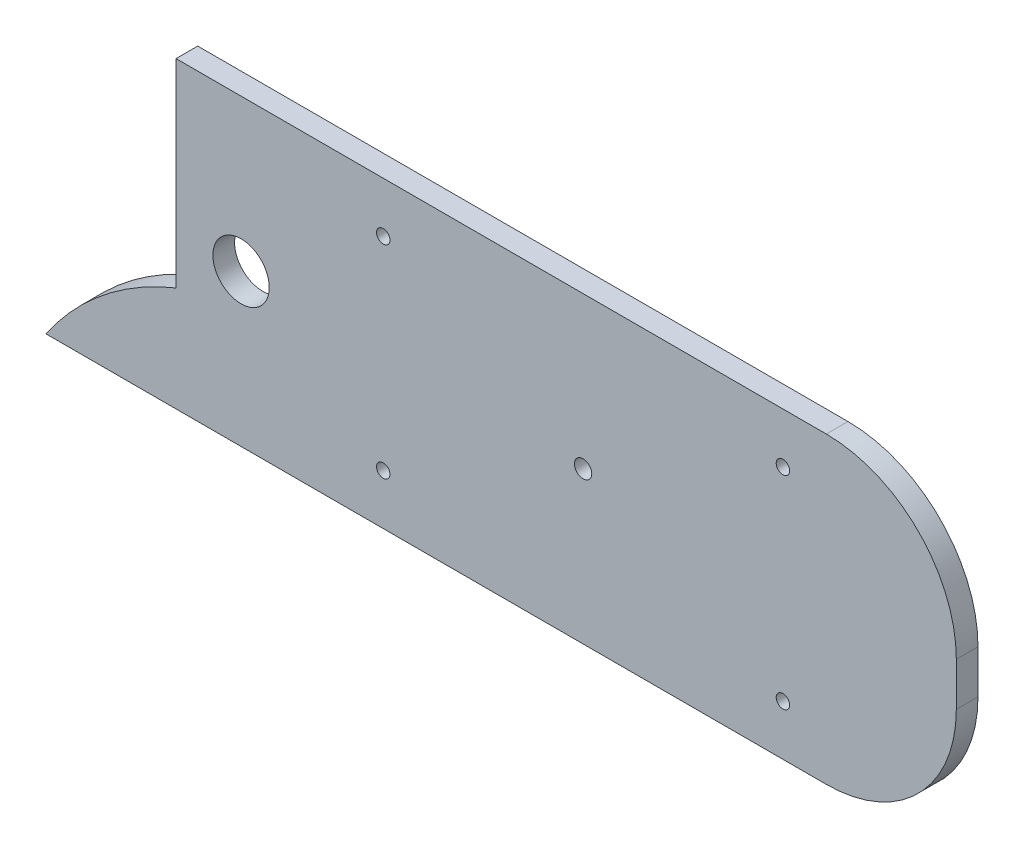
from build123d import *

# Parameters (mm, degrees)
BOSS_EXTRUDE1_DEPTH = 12.7
SKETCH4_R           = 5.08
SKETCH4_R_2         = 3.937
CUT_EXTRUDE2_DEPTH  = 563.396381567
SKETCH5_R           = 16.51
CUT_EXTRUDE3_DEPTH  = 563.396381567


with BuildPart() as part:
    # Sketch2 → Boss-Extrude1 (new body)
    with BuildSketch(Plane.XY):
        with BuildLine():
            Line((0, 0), (457.2, 0))
            ThreePointArc((457.2, 0), (511.081536726, 22.318463274), (533.4, 76.2))
            Line((533.4, 76.2), (533.4, 101.6))
            ThreePointArc((533.4, 101.6), (511.081536726, 155.481536726), (457.2, 177.8))
            Line((457.2, 177.8), (152.4, 177.8))
            Line((152.4, 177.8), (76.2, 177.8))
            Line((76.2, 177.8), (76.2, 61.401251199))
            ThreePointArc((76.2, 61.401251199), (33.506060073, 36.401783403), (0, 0))
        make_face()
    extrude(amount=BOSS_EXTRUDE1_DEPTH)

    # Sketch4 → Cut-Extrude2 (cut, through all)
    with BuildSketch(Plane.XY.offset(12.7)):
        with Locations((314.706, 88.9)):
            Circle(SKETCH4_R)
        with Locations((431.8, 148.336)):
            Circle(SKETCH4_R_2)
        with Locations((197.612, 148.336)):
            Circle(SKETCH4_R_2)
        with Locations((197.612, 29.464)):
            Circle(SKETCH4_R_2)
        with Locations((431.8, 29.464)):
            Circle(SKETCH4_R_2)
    extrude(amount=-CUT_EXTRUDE2_DEPTH, mode=Mode.SUBTRACT)

    # Sketch5 → Cut-Extrude3 (cut, through all)
    with BuildSketch(Plane.XY.offset(12.7)):
        with Locations((114.3, 88.9)):
            Circle(SKETCH5_R)
    extrude(amount=-CUT_EXTRUDE3_DEPTH, mode=Mode.SUBTRACT)


solid = part.part
